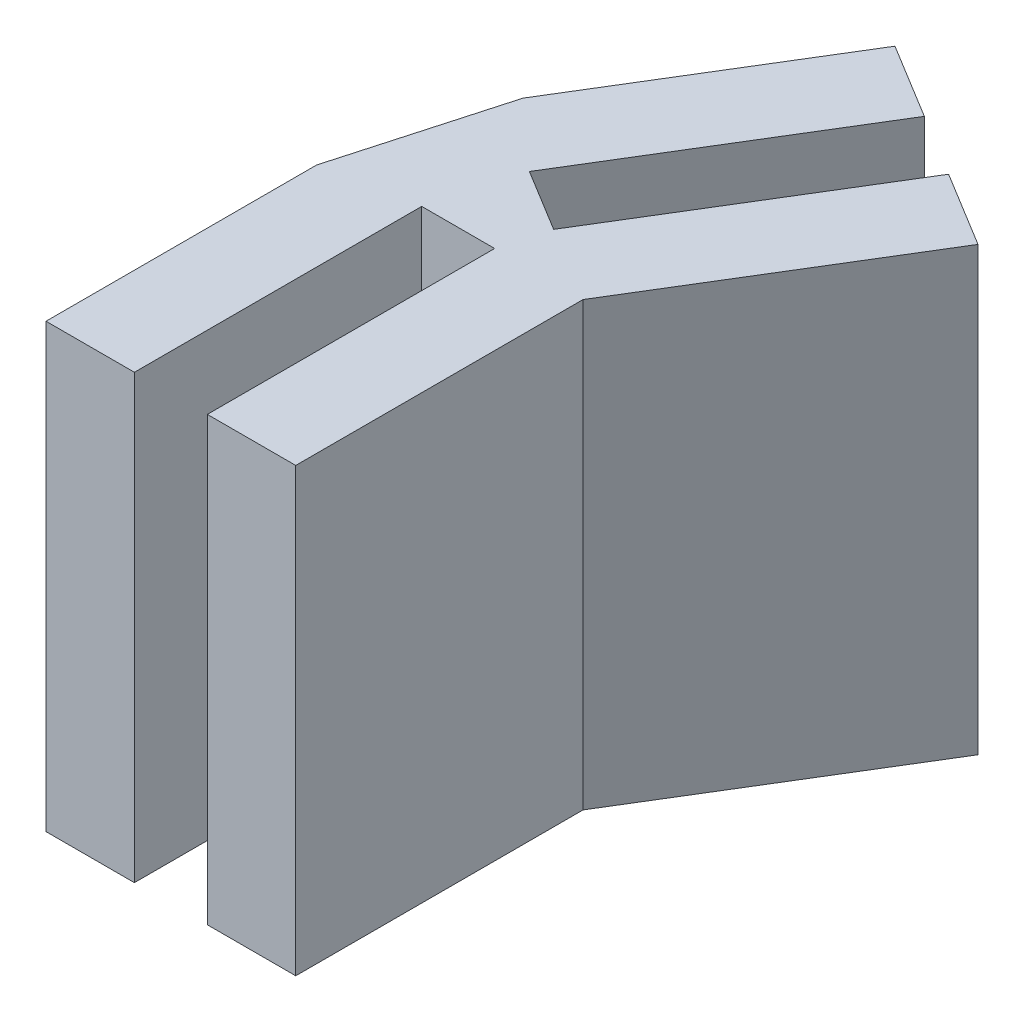
from build123d import *

# Parameters (mm, degrees)
BOSS_EXTRUDE1_DEPTH = 20
CHAMFER1_START      = -5
CHAMFER1_OUTLINE_W  = 22
CHAMFER1_OUTLINE_H  = 11
CHAMFER1_DEPTH      = 1.687562561


with BuildPart() as part:
    # Sketch1 → Boss-Extrude1 (new body)
    with BuildSketch(Plane(origin=(0, 0, 0), x_dir=(1, 0, 0), z_dir=(0, 1, 0))):
        Polygon((0, 0), (4, 0), (4, 13), (7.3, 13), (7.3, 0), (11.3, 0), (11.3, 13), (0, 16.176286751), align=None)
    boss_extrude1 = extrude(amount=BOSS_EXTRUDE1_DEPTH)

    # Mirror1: Boss-Extrude1 across plane
    add(boss_extrude1.mirror(Plane(origin=(11.3, 20, -13), x_dir=(0.9626917464264807, 0, 0.2706004459758567), z_dir=(-0.2706004459758567, 0, 0.9626917464264807))))

    # Chamfer1: read off the stored shape, not the designer's step
    # Chamfer1 outline → Chamfer1 (cut)
    with BuildSketch(Plane(origin=(0, 0, 0), x_dir=(0, 1, 0), z_dir=(0.9626917464264807, 0, 0.2706004459758569)).offset(CHAMFER1_START)):
        with Locations((10, -15.5)):
            Rectangle(CHAMFER1_OUTLINE_W, CHAMFER1_OUTLINE_H)
    extrude(amount=CHAMFER1_DEPTH, mode=Mode.SUBTRACT)


solid = part.part
